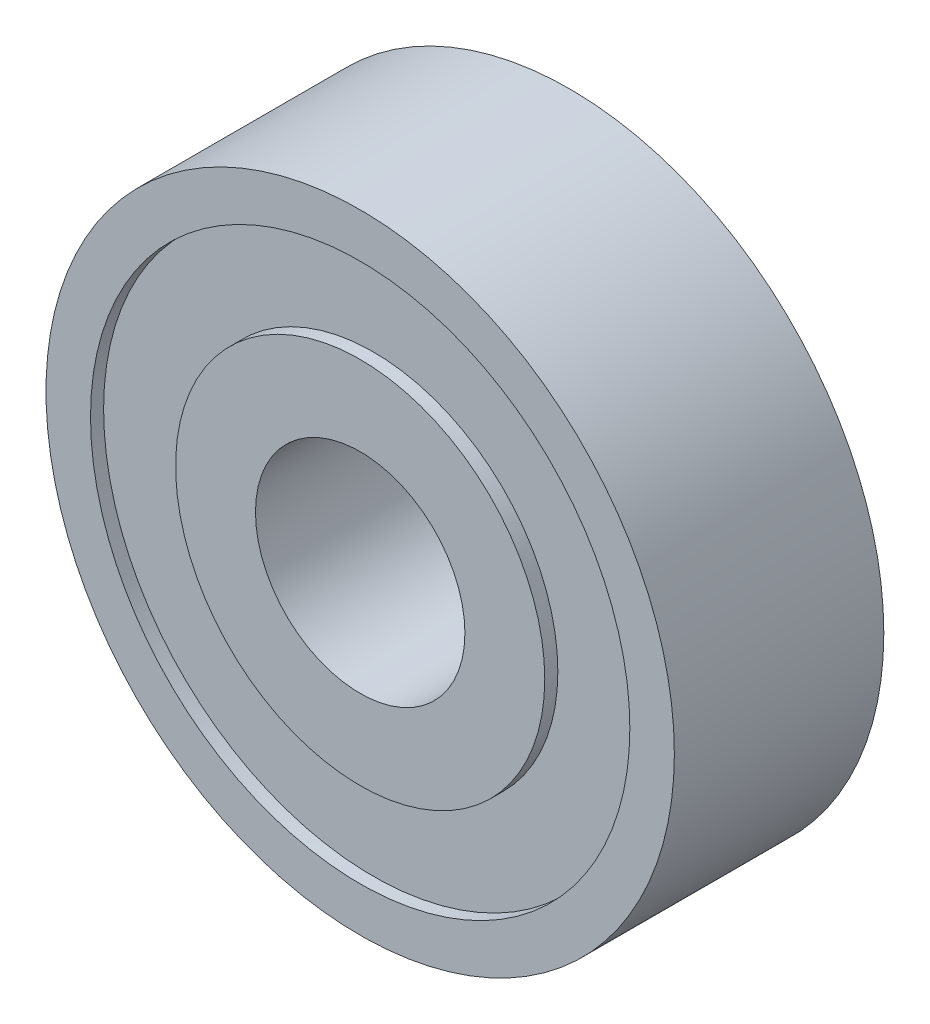
from build123d import *

# Parameters (mm, degrees)
SKETCH_1_R          = 12
EXTRUDE_1_DEPTH     = 4
SKETCH_2_R          = 4
CUT_EXTRUDE_1_DEPTH = 19.761663039
SKETCH_3_R          = 10.3
SKETCH_3_R_2        = 7.05
CUT_EXTRUDE_2_DEPTH = 0.5


with BuildPart() as part:
    # 草圖1 → 填料-伸長1 (new, symmetric)
    with BuildSketch(Plane.XY):
        Circle(SKETCH_1_R)
    extrude(amount=EXTRUDE_1_DEPTH, both=True)

    # 草圖2 → 除料-伸長1 (cut, through all)
    with BuildSketch(Plane.XY.offset(4)):
        Circle(SKETCH_2_R)
    extrude(amount=-CUT_EXTRUDE_1_DEPTH, mode=Mode.SUBTRACT)

    # 草圖3 → 除料-伸長2 (cut)
    with BuildSketch(Plane.XY.offset(4)):
        Circle(SKETCH_3_R)
        Circle(SKETCH_3_R_2, mode=Mode.SUBTRACT)
    cut_extrude_2 = extrude(amount=-CUT_EXTRUDE_2_DEPTH, mode=Mode.SUBTRACT)

    # 鏡射1: 除料-伸長2 across plane
    add(cut_extrude_2.mirror(Plane.XY), mode=Mode.SUBTRACT)


solid = part.part
